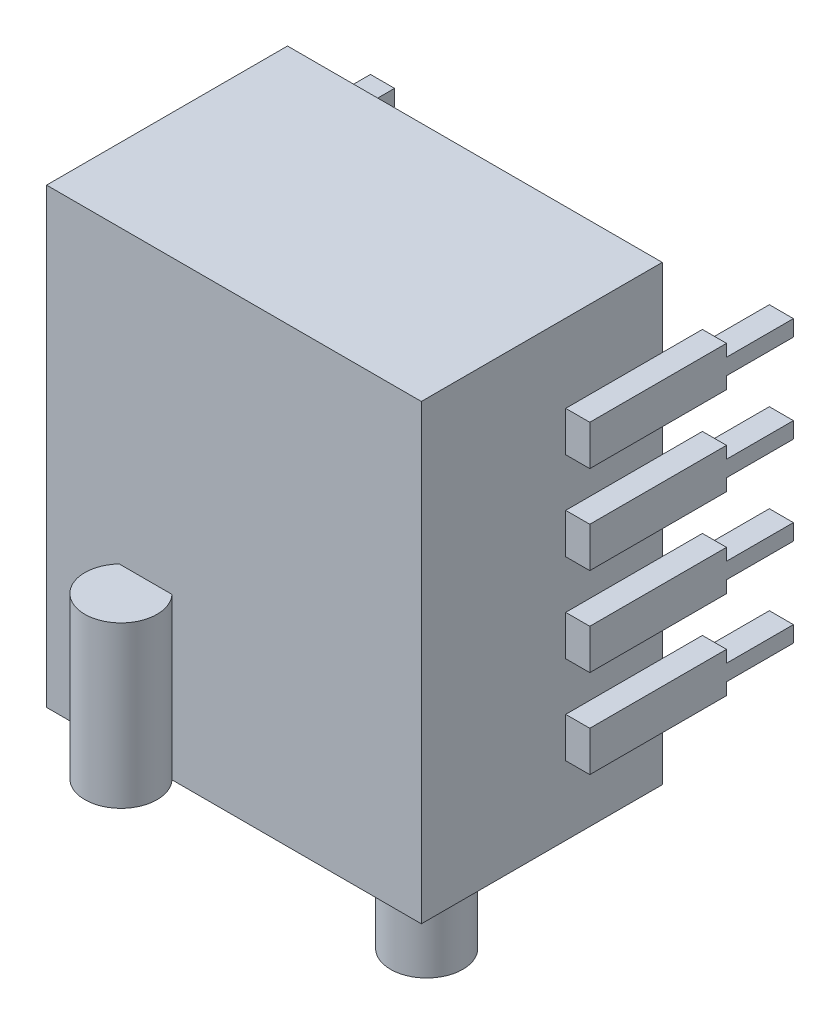
from build123d import *

# Parameters (mm, degrees)
ESQUISSE1_W          = 14
ESQUISSE1_H          = 16.9
BASE_EXTRUSION_DEPTH = 9
ESQUISSE2_R          = 1.35
BOSS_EXTRU_1_DEPTH   = 7.9
ESQUISSE3_R          = 1.35
BOSS_EXTRU_2_DEPTH   = 6
EXTRUSION1_DEPTH     = 0.9
EXTRUSION2_DEPTH     = 0.9


with BuildPart() as part:
    # Esquisse1 → Base-Extrusion (new body)
    with BuildSketch(Plane.XY):
        with Locations((7, 8.45)):
            Rectangle(ESQUISSE1_W, ESQUISSE1_H)
    extrude(amount=BASE_EXTRUSION_DEPTH)

    # Esquisse2 → Boss.-Extru.1 (add)
    with BuildSketch(Plane.XZ):
        with Locations((7, 1.8)):
            Circle(ESQUISSE2_R)
    extrude(amount=BOSS_EXTRU_1_DEPTH)

    # Esquisse3 → Boss.-Extru.2 (add)
    with BuildSketch(Plane.XZ):
        with Locations((3.7, 9.921362126)):
            Circle(ESQUISSE3_R)
    extrude(amount=-BOSS_EXTRU_2_DEPTH)

    # Esquisse4 → Extrusion1 (add)
    with BuildSketch(Plane.ZY):
        Polygon((3.607457233, 13.98057371), (-1.5, 13.98057371), (-1.5, 13.53057371), (-4, 13.53057371), (-4, 12.93057371), (-1.5, 12.93057371), (-1.5, 12.48057371), (3.607457233, 12.48057371), align=None)
        Polygon((3.607457233, 10.68057371), (-1.5, 10.68057371), (-1.5, 10.23057371), (-4, 10.23057371), (-4, 9.63057371), (-1.5, 9.63057371), (-1.5, 9.18057371), (3.607457233, 9.18057371), align=None)
        Polygon((3.607457233, 7.38057371), (-1.5, 7.38057371), (-1.5, 6.93057371), (-4, 6.93057371), (-4, 6.33057371), (-1.5, 6.33057371), (-1.5, 5.88057371), (3.607457233, 5.88057371), align=None)
        Polygon((3.607457233, 4.08057371), (-1.5, 4.08057371), (-1.5, 3.63057371), (-4, 3.63057371), (-4, 3.03057371), (-1.5, 3.03057371), (-1.5, 2.58057371), (3.607457233, 2.58057371), align=None)
    extrude(amount=EXTRUSION1_DEPTH)

    # Esquisse5 → Extrusion2 (add)
    with BuildSketch(Plane(origin=(14, 0, 0), x_dir=(0, 0, -1), z_dir=(1, 0, 0))):
        Polygon((1.5, 13.98057371), (-3.607457233, 13.98057371), (-3.607457233, 12.48057371), (1.5, 12.48057371), (1.5, 12.93057371), (4, 12.93057371), (4, 13.53057371), (1.5, 13.53057371), align=None)
        Polygon((1.5, 7.38057371), (-3.607457233, 7.38057371), (-3.607457233, 5.88057371), (1.5, 5.88057371), (1.5, 6.33057371), (4, 6.33057371), (4, 6.93057371), (1.5, 6.93057371), align=None)
        Polygon((-3.607457233, 10.68057371), (-3.607457233, 9.18057371), (1.5, 9.18057371), (1.5, 9.63057371), (4, 9.63057371), (4, 10.23057371), (1.5, 10.23057371), (1.5, 10.68057371), align=None)
        Polygon((-3.607457233, 4.08057371), (-3.607457233, 2.58057371), (1.5, 2.58057371), (1.5, 3.03057371), (4, 3.03057371), (4, 3.63057371), (1.5, 3.63057371), (1.5, 4.08057371), align=None)
    extrude(amount=EXTRUSION2_DEPTH)


solid = part.part
